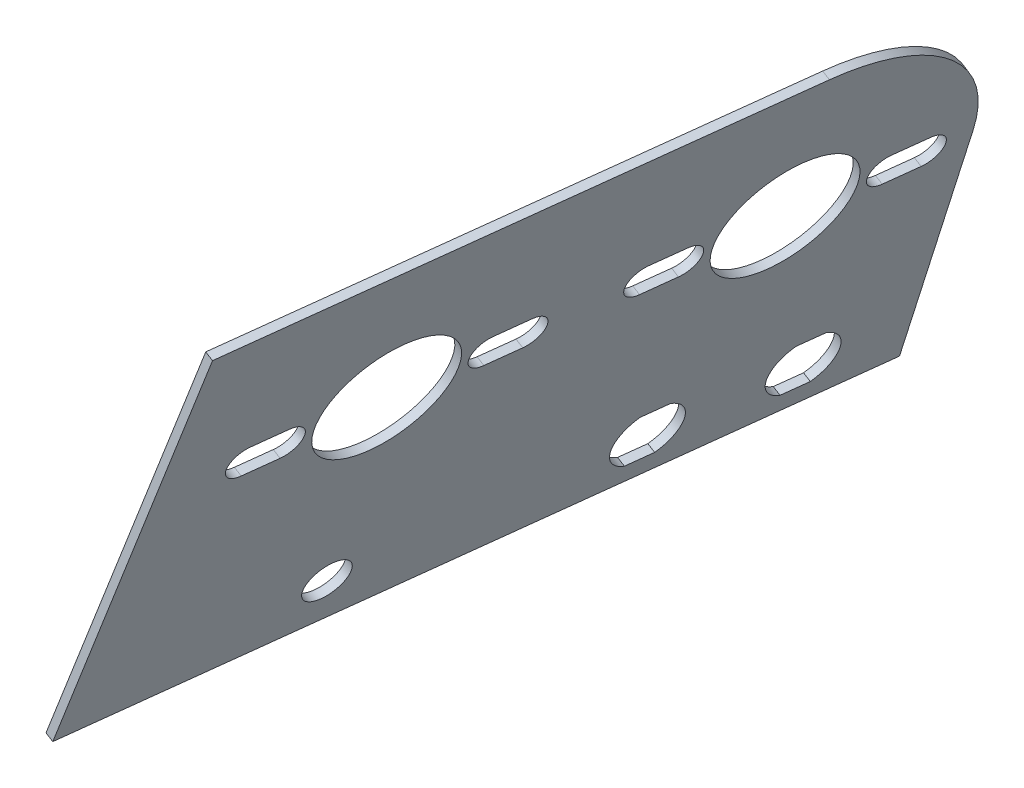
from build123d import *

# Parameters (mm, degrees)
SKETCH39_R          = 11.90625
SKETCH39_R_2        = 4.024999951
BOSS_EXTRUDE1_DEPTH = 1.5875


with BuildPart() as part:
    # Sketch39 → Boss-Extrude1 (new body)
    with BuildSketch(Plane(origin=(-441.521969452, 172.104793819, -62.182961286), x_dir=(-0.12122181659134343, 0.04725213510134499, 0.9915001295565519), z_dir=(-0.923798474245107, 0.3600956621414251, -0.1301056996804562))):
        with BuildLine():
            Line((-228.044977909, 213.495528257), (-90.363815922, 201.963804234))
            Line((-90.363815922, 201.963804234), (-90.363815922, 283.724086083))
            Line((-90.363815922, 283.724086083), (-190.676741831, 292.125968815))
            ThreePointArc((-190.676741831, 292.125968815), (-213.041445426, 284.983204878), (-223.80498218, 264.11827449))
            Line((-223.80498218, 264.11827449), (-228.044977909, 213.495528257))
        make_face()
        with Locations((-128.463815922, 256.132810093)):
            Circle(SKETCH39_R, mode=Mode.SUBTRACT)
        with Locations((-193.237014843, 261.558001479)):
            Circle(SKETCH39_R, mode=Mode.SUBTRACT)
        with Locations((-131.908812452, 215.001828778)):
            Circle(SKETCH39_R_2, mode=Mode.SUBTRACT)
        with BuildLine():
            Line((-211.342041249, 227.174154397), (-206.415245302, 226.761502075))
            ThreePointArc((-206.415245302, 226.761502075), (-203.328738088, 220.983728264), (-207.333354614, 215.799883796))
            Line((-207.333354614, 215.799883796), (-212.260150561, 216.212536118))
            ThreePointArc((-212.260150561, 216.212536118), (-215.346657775, 221.990309928), (-211.342041249, 227.174154397))
        make_face(mode=Mode.SUBTRACT)
        with BuildLine():
            Line((-186.030668133, 225.054156527), (-181.103872186, 224.641504205))
            ThreePointArc((-181.103872186, 224.641504205), (-178.017364976, 218.8637304), (-182.021981496, 213.679885937))
            Line((-182.021981496, 213.679885937), (-186.948777443, 214.092538259))
            ThreePointArc((-186.948777443, 214.092538259), (-190.035284653, 219.870312063), (-186.030668133, 225.054156527))
        make_face(mode=Mode.SUBTRACT)
        with BuildLine():
            Line((-215.859429659, 266.728109418), (-209.53158638, 266.198109952))
            ThreePointArc((-209.53158638, 266.198109952), (-206.55149466, 262.673178781), (-210.076425831, 259.693087061))
            Line((-210.076425831, 259.693087061), (-216.40426911, 260.223086527))
            ThreePointArc((-216.40426911, 260.223086527), (-219.38436083, 263.748017698), (-215.859429659, 266.728109418))
        make_face(mode=Mode.SUBTRACT)
        with BuildLine():
            Line((-170.614600027, 256.387893539), (-176.942443306, 256.917893006))
            ThreePointArc((-176.942443306, 256.917893006), (-179.922535026, 260.442824177), (-176.397603855, 263.422915897))
            Line((-176.397603855, 263.422915897), (-170.069760576, 262.89291643))
            ThreePointArc((-170.069760576, 262.89291643), (-167.089668856, 259.367985259), (-170.614600027, 256.387893539))
        make_face(mode=Mode.SUBTRACT)
        with BuildLine():
            Line((-151.086230738, 261.302918032), (-144.758387459, 260.772918566))
            ThreePointArc((-144.758387459, 260.772918566), (-141.778295739, 257.247987395), (-145.30322691, 254.267895675))
            Line((-145.30322691, 254.267895675), (-151.631070189, 254.797895141))
            ThreePointArc((-151.631070189, 254.797895141), (-154.611161909, 258.322826312), (-151.086230738, 261.302918032))
        make_face(mode=Mode.SUBTRACT)
        with BuildLine():
            Line((-105.841401106, 250.962702154), (-112.169244385, 251.49270162))
            ThreePointArc((-112.169244385, 251.49270162), (-115.149336105, 255.017632791), (-111.624404934, 257.997724511))
            Line((-111.624404934, 257.997724511), (-105.296561655, 257.467725045))
            ThreePointArc((-105.296561655, 257.467725045), (-102.316469935, 253.942793873), (-105.841401106, 250.962702154))
        make_face(mode=Mode.SUBTRACT)
    extrude(amount=BOSS_EXTRUDE1_DEPTH)


solid = part.part
